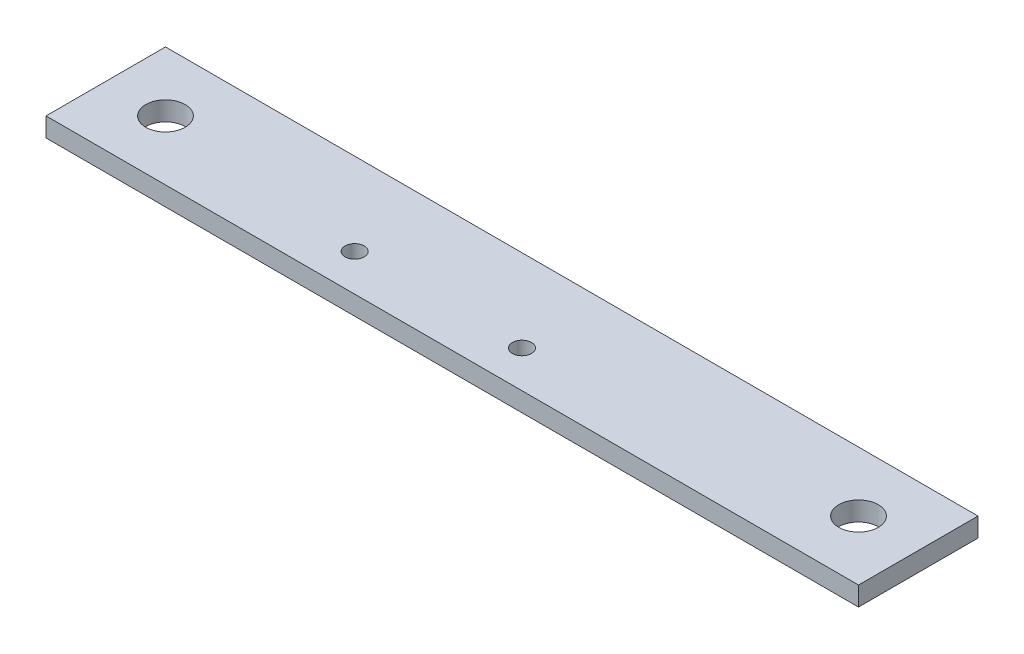
from build123d import *

# Parameters (mm, degrees)
SKETCH1_W           = 170
SKETCH1_H           = 25
SKETCH1_R           = 2
SKETCH1_R_2         = 4.125
BOSS_EXTRUDE1_DEPTH = 4
SKETCH2_R           = 4.125
CUT_EXTRUDE1_DEPTH  = 87.007267135


with BuildPart() as part:
    # Sketch1 → Boss-Extrude1 (new body)
    with BuildSketch(Plane(origin=(0, 0, 0), x_dir=(1, 0, 0), z_dir=(0, 1, 0))):
        Rectangle(SKETCH1_W, SKETCH1_H)
        with Locations((-28.158485727, -4.763382536)):
            Circle(SKETCH1_R, mode=Mode.SUBTRACT)
        with Locations((6.841514273, -4.763382536)):
            Circle(SKETCH1_R, mode=Mode.SUBTRACT)
        with Locations((72.5, 0)):
            Circle(SKETCH1_R_2, mode=Mode.SUBTRACT)
    extrude(amount=BOSS_EXTRUDE1_DEPTH)

    # Sketch2 → Cut-Extrude1 (cut, through all)
    with BuildSketch(Plane(origin=(0, 4, 0), x_dir=(1, 0, 0), z_dir=(0, 1, 0))):
        with Locations((-72.5, 0)):
            Circle(SKETCH2_R)
    extrude(amount=-CUT_EXTRUDE1_DEPTH, mode=Mode.SUBTRACT)


solid = part.part
